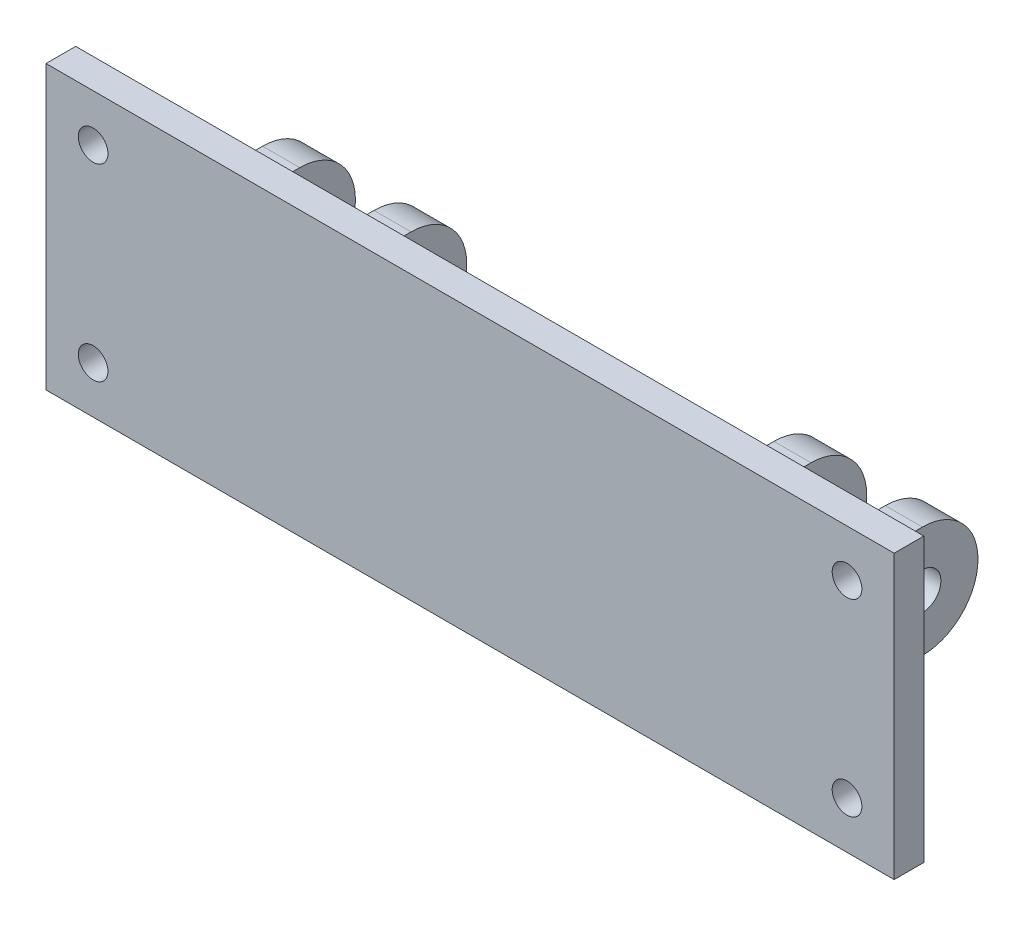
from build123d import *

# Parameters (mm, degrees)
SKETCH1_W           = 228.6
SKETCH1_H           = 76.2
SKETCH1_R           = 4
SKETCH1_W_2         = 10
SKETCH1_H_2         = 30
BOSS_EXTRUDE1_DEPTH = 8
SKETCH1_3_W         = 10
SKETCH1_3_H         = 30
BOSS_EXTRUDE2_DEPTH = 40
FILLET1_R           = 3
SKETCH2_R           = 5
CUT_EXTRUDE1_DEPTH  = 211.575046005
FILLET2_R           = 15


with BuildPart() as part:
    # Sketch1 → Boss-Extrude1 (new body)
    # profile 1 of 5: a face of its own
    with BuildSketch(Plane.XY):
        Rectangle(SKETCH1_W, SKETCH1_H)
        with Locations((-101.6, -25.4)):
            Circle(SKETCH1_R, mode=Mode.SUBTRACT)
        with Locations((101.6, -25.4)):
            Circle(SKETCH1_R, mode=Mode.SUBTRACT)
        with Locations((101.6, 25.4)):
            Circle(SKETCH1_R, mode=Mode.SUBTRACT)
        with Locations((-101.6, 25.4)):
            Circle(SKETCH1_R, mode=Mode.SUBTRACT)
        with Locations((53.9, 0)):
            Rectangle(SKETCH1_W_2, SKETCH1_H_2, mode=Mode.SUBTRACT)
        with Locations((83.9, 0)):
            Rectangle(SKETCH1_W_2, SKETCH1_H_2, mode=Mode.SUBTRACT)
        with Locations((-83.9, 0)):
            Rectangle(SKETCH1_W_2, SKETCH1_H_2, mode=Mode.SUBTRACT)
        with Locations((-53.9, 0)):
            Rectangle(SKETCH1_W_2, SKETCH1_H_2, mode=Mode.SUBTRACT)
    # profile 2 of 5: a face of its own
    with BuildSketch(Plane.XY):
        with Locations((-53.9, 0)):
            Rectangle(SKETCH1_W_2, SKETCH1_H_2)
    # profile 3 of 5: a face of its own
    with BuildSketch(Plane.XY):
        with Locations((-83.9, 0)):
            Rectangle(SKETCH1_W_2, SKETCH1_H_2)
    # profile 4 of 5: a face of its own
    with BuildSketch(Plane.XY):
        with Locations((53.9, 0)):
            Rectangle(SKETCH1_W_2, SKETCH1_H_2)
    # profile 5 of 5: a face of its own
    with BuildSketch(Plane.XY):
        with Locations((83.9, 0)):
            Rectangle(SKETCH1_W_2, SKETCH1_H_2)
    extrude(amount=BOSS_EXTRUDE1_DEPTH)

    # Sketch1<3> → Boss-Extrude2 (add)
    with BuildSketch(Plane.XY):
        with Locations((-83.9, 0)):
            Rectangle(SKETCH1_3_W, SKETCH1_3_H)
        with Locations((-53.9, 0)):
            Rectangle(SKETCH1_3_W, SKETCH1_3_H)
        with Locations((83.9, 0)):
            Rectangle(SKETCH1_3_W, SKETCH1_3_H)
        with Locations((53.9, 0)):
            Rectangle(SKETCH1_3_W, SKETCH1_3_H)
    extrude(amount=-BOSS_EXTRUDE2_DEPTH)

    # Fillet1
    fillet1_edges = [part.edges().sort_by_distance(p)[0] for p in [
        (-83.9, 15, 0),
        (-88.9, 0, 0),
        (-83.9, -15, 0),
        (-48.9, 0, 0),
        (-53.9, 15, 0),
        (-53.9, -15, 0),
        (88.9, 0, 0),
        (83.9, -15, 0),
        (83.9, 15, 0),
        (53.9, -15, 0),
        (53.9, 15, 0),
        (48.9, 0, 0),
    ]]
    fillet(fillet1_edges, radius=FILLET1_R)

    # Sketch2 → Cut-Extrude1 (cut, through all)
    with BuildSketch(Plane.ZY.offset(88.9)):
        with Locations((-25, 0)):
            Circle(SKETCH2_R)
    extrude(amount=-CUT_EXTRUDE1_DEPTH, mode=Mode.SUBTRACT)

    # Fillet2
    fillet2_edges = [part.edges().sort_by_distance(p)[0] for p in [
        (53.9, 15, -40),
        (53.9, -15, -40),
        (83.9, 15, -40),
        (83.9, -15, -40),
        (-53.9, 15, -40),
        (-53.9, -15, -40),
        (-83.9, -15, -40),
        (-83.9, 15, -40),
    ]]
    fillet(fillet2_edges, radius=FILLET2_R - 0.0001)  # a hair under: the kernel refuses the full size


solid = part.part
